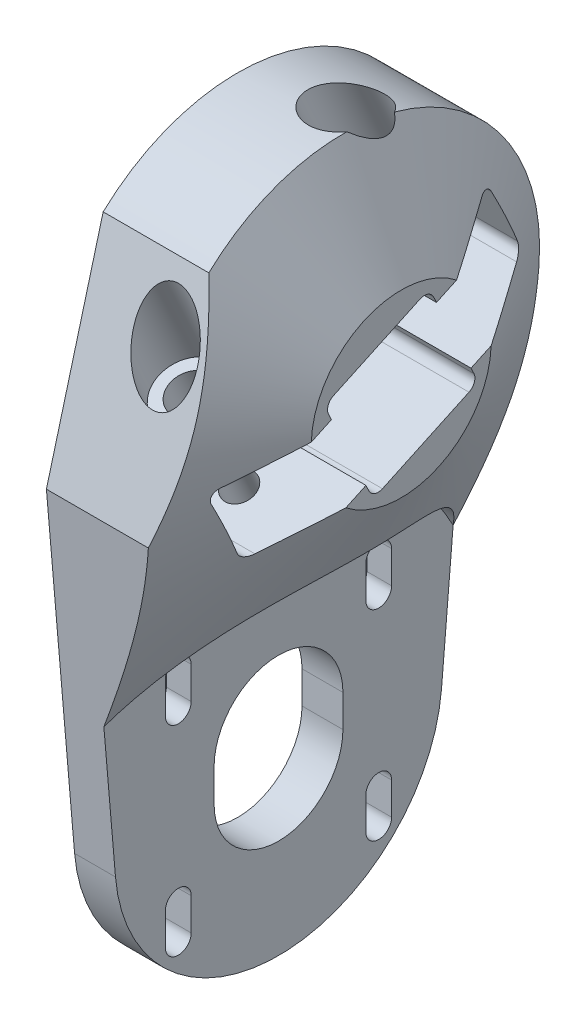
from build123d import *

# Parameters (mm, degrees)
BOSS_EXTRUDE1_DEPTH = 6.35
CUT_EXTRUDE18_DEPTH = 10
SKETCH20_R          = 57.15
BOSS_EXTRUDE5_DEPTH = 19.05
CUT_EXTRUDE14_DEPTH = 106.568863781
SKETCH22_R          = 3.175
CUT_EXTRUDE15_DEPTH = 112.672649781
SKETCH24_R          = 5
CUT_EXTRUDE16_DEPTH = 117.574618566
SKETCH25_R          = 2.38125
CUT_EXTRUDE17_DEPTH = 10
CHAMFER2_SIZE       = 2.5
FILLET1_R           = 1.5875
SKETCH28_R          = 30.48
CUT_EXTRUDE19_DEPTH = 105.22344993
CUT_EXTRUDE20_DEPTH = 100.947550226
CUT_EXTRUDE21_DEPTH = 94.849309593


with BuildPart() as part:
    # Sketch1 → Boss-Extrude1 (new body)
    with BuildSketch(Plane(origin=(0, 0, 0), x_dir=(0, 0, -1), z_dir=(1, 0, 0))):
        with BuildLine():
            ThreePointArc((30.369265969, -2.595782062), (0, 30.48), (-30.369265969, -2.595782062))
            Line((-30.369265969, -2.595782062), (-25.307721641, -61.813151718))
            ThreePointArc((-25.307721641, -61.813151718), (0, -85.05), (25.307721641, -61.813151718))
            Line((25.307721641, -61.813151718), (30.369265969, -2.595782062))
        make_face()
        Polygon((-11.960334439, 4.353205728), (4.353205728, 11.960334439), (11.960334439, -4.353205728), (-4.353205728, -11.960334439), align=None, mode=Mode.SUBTRACT)
    extrude(amount=BOSS_EXTRUDE1_DEPTH)

    # Sketch19 → Cut-Extrude18 (cut)
    with BuildSketch(Plane(origin=(6.35, 0, 0), x_dir=(0, 0, -1), z_dir=(1, 0, 0))):
        with BuildLine():
            Line((13.556349186, -39.093650814), (13.556349186, -44.093650814))
            ThreePointArc((13.556349186, -44.093650814), (15.556349186, -46.093650814), (17.556349186, -44.093650814))
            Line((17.556349186, -44.093650814), (17.556349186, -39.093650806))
            ThreePointArc((17.556349186, -39.093650806), (15.556349182, -37.093650814), (13.556349186, -39.093650814))
        make_face()
        with BuildLine():
            Line((-10, -54.65), (-10, -59.65))
            ThreePointArc((-10, -59.65), (0, -69.65), (10, -59.65))
            Line((10, -59.65), (10, -54.65))
            ThreePointArc((10, -54.65), (0, -44.65), (-10, -54.65))
        make_face()
        with BuildLine():
            Line((17.556349186, -75.206349194), (17.556349186, -70.206349186))
            ThreePointArc((17.556349186, -70.206349186), (15.556349186, -68.206349186), (13.556349186, -70.206349186))
            Line((13.556349186, -70.206349186), (13.556349186, -75.206349186))
            ThreePointArc((13.556349186, -75.206349186), (15.556349182, -77.206349186), (17.556349186, -75.206349194))
        make_face()
        with BuildLine():
            Line((-17.556349186, -39.093650806), (-17.556349186, -44.093650814))
            ThreePointArc((-17.556349186, -44.093650814), (-15.556349186, -46.093650814), (-13.556349186, -44.093650814))
            Line((-13.556349186, -44.093650814), (-13.556349186, -39.093650814))
            ThreePointArc((-13.556349186, -39.093650814), (-15.556349182, -37.093650814), (-17.556349186, -39.093650806))
        make_face()
        with BuildLine():
            Line((-13.556349186, -75.206349186), (-13.556349186, -70.206349186))
            ThreePointArc((-13.556349186, -70.206349186), (-15.556349186, -68.206349186), (-17.556349186, -70.206349186))
            Line((-17.556349186, -70.206349186), (-17.556349186, -75.206349194))
            ThreePointArc((-17.556349186, -75.206349194), (-15.556349182, -77.206349186), (-13.556349186, -75.206349186))
        make_face()
    extrude(amount=-CUT_EXTRUDE18_DEPTH, mode=Mode.SUBTRACT)

    # Sketch20 → Boss-Extrude5 (add)
    with BuildSketch(Plane(origin=(6.35, 0, 0), x_dir=(0, 0, -1), z_dir=(1, 0, 0))):
        Circle(SKETCH20_R)
    extrude(amount=BOSS_EXTRUDE5_DEPTH)

    # Sketch21 → Cut-Extrude14 (cut, through all)
    with BuildSketch(Plane.ZY):
        Polygon((-19.067760927, 15.897892729), (-24.435012851, 4.387783834), (-10.840396045, -1.951490092), (-11.960334439, -4.353205728), (4.353205728, -11.960334439), (5.473144121, -9.558618803), (19.067760927, -15.897892729), (24.435012851, -4.387783834), (10.840396045, 1.951490092), (11.960334439, 4.353205728), (-4.353205728, 11.960334439), (-5.473144121, 9.558618803), align=None)
    extrude(amount=-CUT_EXTRUDE14_DEPTH, mode=Mode.SUBTRACT)

    # Sketch22 → Cut-Extrude15 (cut, through all)
    with BuildSketch(Plane(origin=(0, 5.755054448, 2.683625962), x_dir=(-1, 0, 0), z_dir=(0, -0.9063077870366495, -0.4226182617407005))):
        with Locations((-12.5, -16.5)):
            Circle(SKETCH22_R)
    cut_extrude15 = extrude(amount=-CUT_EXTRUDE15_DEPTH, mode=Mode.SUBTRACT)

    # Sketch24 → Cut-Extrude16 (cut, through all)
    with BuildSketch(Plane(origin=(0, 10.359098006, 4.830526732), x_dir=(-1, 0, 0), z_dir=(0, -0.9063077870366495, -0.4226182617407005))):
        with Locations((-12.5, -16.5)):
            Circle(SKETCH24_R)
    cut_extrude16 = extrude(amount=-CUT_EXTRUDE16_DEPTH, mode=Mode.SUBTRACT)

    # Sketch25 → Cut-Extrude17 (cut)
    with BuildSketch(Plane(origin=(0, -5.755054448, -2.683625962), x_dir=(1, 0, 0), z_dir=(0, 0.9063077870366495, 0.4226182617407006))):
        with Locations((12.5, -16.5)):
            Circle(SKETCH25_R)
    cut_extrude17 = extrude(amount=-CUT_EXTRUDE17_DEPTH, mode=Mode.SUBTRACT)

    # Mirror1: Cut-Extrude15, Cut-Extrude16, Cut-Extrude17 across plane
    add(cut_extrude15.mirror(Plane(origin=(0, 0, 0), x_dir=(1, 0, 0), z_dir=(0, 0.42261826174070105, -0.9063077870366493))), mode=Mode.SUBTRACT)
    add(cut_extrude16.mirror(Plane(origin=(0, 0, 0), x_dir=(1, 0, 0), z_dir=(0, 0.42261826174070105, -0.9063077870366493))), mode=Mode.SUBTRACT)
    add(cut_extrude17.mirror(Plane(origin=(0, 0, 0), x_dir=(1, 0, 0), z_dir=(0, 0.42261826174070105, -0.9063077870366493))), mode=Mode.SUBTRACT)


with BuildPart() as body_2:
    # Mirror2: mirrored copy
    add(part.part.mirror(Plane(origin=(0, 0, 0), x_dir=(0, 0, 1), z_dir=(1, 0, 0))))


with BuildPart() as part_1:
    add(part.part)

    # Chamfer2
    chamfer2_edges = [part_1.edges().sort_by_distance(p)[0] for p in [
        (0, -46.093650814, 15.556349186),
        (0, -41.593650814, 13.556349186),
        (0, -37.093650814, 15.556349182),
        (0, -41.59365081, 17.556349186),
        (0, -46.093650814, -15.556349186),
        (0, -41.59365081, -17.556349186),
        (0, -41.593650814, -13.556349186),
        (0, -37.093650814, -15.556349182),
    ]]
    chamfer(chamfer2_edges, length=CHAMFER2_SIZE)

    # Fillet1
    fillet1_edges = [part_1.edges().sort_by_distance(p)[0] for p in [
        (12.7, -4.353205728, -11.960334439),
        (12.7, 4.387783834, -24.435012851),
        (12.7, 11.960334439, -4.353205728),
        (12.7, 15.897892729, -19.067760927),
        (12.7, -4.387783834, 24.435012851),
        (12.7, 4.353205728, 11.960334439),
        (12.7, -11.960334439, 4.353205728),
        (12.7, -15.897892729, 19.067760927),
    ]]
    fillet(fillet1_edges, radius=FILLET1_R)

    # Sketch28 → Cut-Extrude19 (cut, through all)
    with BuildSketch(Plane(origin=(6.35, 0, 0), x_dir=(0, 0, -1), z_dir=(1, 0, 0))):
        with Locations((0, -54.65)):
            Circle(SKETCH28_R)
    extrude(amount=CUT_EXTRUDE19_DEPTH, mode=Mode.SUBTRACT)

    # Sketch31 → Cut-Revolve1 (revolve, cut)
    with BuildSketch(Plane(origin=(0, 0, 0), x_dir=(1, 0, 0), z_dir=(0, 1, 0))):
        Polygon((25.4, -59.952108656), (25.4, -13.97), (6.35, -48.91940088), (6.35, -59.952108656), align=None)
    revolve(axis=Axis((25.4, 0, 0), (-1, 0, 0)), mode=Mode.SUBTRACT)

    # Sketch32 → Cut-Extrude20 (cut, through all)
    with BuildSketch(Plane.ZY.offset(-6.35)):
        with BuildLine():
            ThreePointArc((-30.369265969, -2.595782062), (0, 30.48), (30.369265969, -2.595782062))
            Line((30.369265969, -2.595782062), (27.110634253, -40.720035521))
            ThreePointArc((27.110634253, -40.720035521), (43.123913132, -23.096231265), (48.91940088, 0))
            ThreePointArc((48.91940088, 0), (-23.096231265, 43.123913132), (-27.110634253, -40.720035521))
            Line((-27.110634253, -40.720035521), (-30.369265969, -2.595782062))
        make_face()
    extrude(amount=-CUT_EXTRUDE20_DEPTH, mode=Mode.SUBTRACT)

    # Sketch33 → Cut-Extrude21 (cut, through all)
    with BuildSketch(Plane.ZY):
        with BuildLine():
            Line((29.679571242, -10.664842593), (30.369265969, -2.595782062))
            ThreePointArc((30.369265969, -2.595782062), (28.464776298, 10.898940787), (20.869520673, 22.214713747))
            Line((20.869520673, 22.214713747), (29.679571242, -10.664842593))
        make_face()
    extrude(amount=-CUT_EXTRUDE21_DEPTH, mode=Mode.SUBTRACT)


solid = part_1.part
